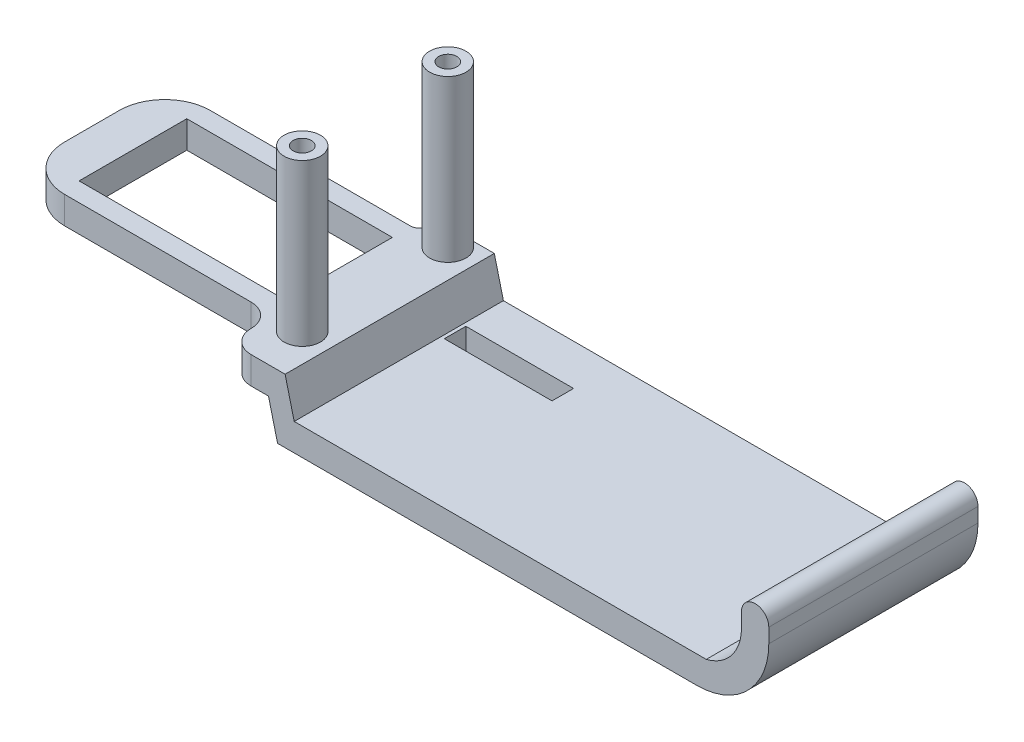
from build123d import *

# Parameters (mm, degrees)
SKETCH1_W               = 28
SKETCH1_H               = 16
SKETCH1_W_2             = 22.6
SKETCH1_H_2             = 11.84
BOSS_EXTRUDE1_DEPTH     = 3
BOSS_EXTRU_1_DEPTH      = 5
BOSS_EXTRU_1_DEPTH_BACK = 18
ESQUISSE6_R             = 2
BOSS_EXTRU_3_DEPTH      = 17.7
ESQUISSE7_R             = 1
ENL_V_MAT_EXTRU_3_DEPTH = 4
ESQUISSE8_W             = 11.84
ESQUISSE8_H             = 2.37
ENL_V_MAT_EXTRU_4_DEPTH = 10
CONG_1_R                = 1
CONG_3_R                = 5
CONG_4_R                = 2.5
BOSS_EXTRUDE2_DEPTH     = 23


with BuildPart() as part:
    # Sketch1 → Boss-Extrude1 (new body)
    with BuildSketch(Plane(origin=(0, 0, 0), x_dir=(1, 0, 0), z_dir=(0, 1, 0))):
        with Locations((14, 8)):
            Rectangle(SKETCH1_W, SKETCH1_H)
        with Locations((15.8, 8)):
            Rectangle(SKETCH1_W_2, SKETCH1_H_2, mode=Mode.SUBTRACT)
    extrude(amount=BOSS_EXTRUDE1_DEPTH)

    # Esquisse1 → Boss.-Extru.1 (add, two sides: drawn at the far end of the back side and taken through both)
    with BuildSketch(Plane.XY.offset(-BOSS_EXTRU_1_DEPTH_BACK)):
        Polygon((34.226941016, 3), (35.226941016, -1), (62.4, -1), (62.4, -4), (33.4, -4), (32.4, 0), (28, 0), (28, 3), align=None)
    extrude(amount=BOSS_EXTRU_1_DEPTH + BOSS_EXTRU_1_DEPTH_BACK)

    # Esquisse6 → Boss.-Extru.3 (add)
    with BuildSketch(Plane(origin=(0, 3, 0), x_dir=(1, 0, 0), z_dir=(0, 1, 0))):
        with Locations(Location((31.113470508, 0, 0), (0, 0, 90))):
            Circle(ESQUISSE6_R)
        with Locations(Location((31.113470508, 16, 0), (0, 0, 90))):
            Circle(ESQUISSE6_R)
    extrude(amount=BOSS_EXTRU_3_DEPTH)

    # Esquisse7 → Enlèv. mat.-Extru.3 (cut)
    with BuildSketch(Plane(origin=(0, 20.7, 0), x_dir=(1, 0, 0), z_dir=(0, 1, 0))):
        with Locations(Location((31.113470508, 16, 0), (0, 0, 270))):
            Circle(ESQUISSE7_R)
        with Locations(Location((31.113470508, 0, 0), (0, 0, 270))):
            Circle(ESQUISSE7_R)
    extrude(amount=-ENL_V_MAT_EXTRU_3_DEPTH, mode=Mode.SUBTRACT)

    # Esquisse8 → Enlèv. mat.-Extru.4 (cut)
    with BuildSketch(Plane(origin=(0, -1, 0), x_dir=(1, 0, 0), z_dir=(0, 1, 0))):
        with Locations((41.52, 12.315)):
            Rectangle(ESQUISSE8_W, ESQUISSE8_H)
    extrude(amount=-ENL_V_MAT_EXTRU_4_DEPTH, mode=Mode.SUBTRACT)

    # Congé1
    cong_1_edges = [part.edges().sort_by_distance(p)[0] for p in [
        (28, 1.5, -16),
    ]]
    fillet(cong_1_edges, radius=CONG_1_R)
    cong_1_2_edges = [part.edges().sort_by_distance(p)[0] for p in [
        (28, 1.5, -18),
    ]]
    fillet(cong_1_2_edges, radius=CONG_1_R - 0.0001)  # a hair under: the kernel refuses the full size

    # Congé3
    cong_3_edges = [part.edges().sort_by_distance(p)[0] for p in [
        (0, 1.5, 0),
        (0, 1.5, -16),
    ]]
    fillet(cong_3_edges, radius=CONG_3_R)

    # Congé4
    cong_4_edges = [part.edges().sort_by_distance(p)[0] for p in [
        (28, 1.5, 0),
    ]]
    fillet(cong_4_edges, radius=CONG_4_R)
    cong_4_2_edges = [part.edges().sort_by_distance(p)[0] for p in [
        (28, 1.5, 5),
    ]]
    fillet(cong_4_2_edges, radius=CONG_4_R - 0.0001)  # a hair under: the kernel refuses the full size

    # Sketch3 → Boss-Extrude2 (add)
    with BuildSketch(Plane.XY.offset(5)):
        with BuildLine():
            Line((62.4, -1), (62.4, -4))
            Line((62.4, -4), (79.480551105, -4))
            ThreePointArc((79.480551105, -4), (85.080447122, -1.680447122), (87.4, 3.919448895))
            Line((87.4, 3.919448895), (87.4, 5.5))
            ThreePointArc((87.4, 5.5), (85.9, 7), (84.4, 5.5))
            Line((84.4, 5.5), (84.4, 3.919448895))
            ThreePointArc((84.4, 3.919448895), (83.315910874, 0.78923852), (80.528063722, -1))
            Line((80.528063722, -1), (79.4, -1))
            Line((79.4, -1), (71.856339273, -1))
            Line((71.856339273, -1), (62.4, -1))
        make_face()
    extrude(amount=-BOSS_EXTRUDE2_DEPTH)


solid = part.part
